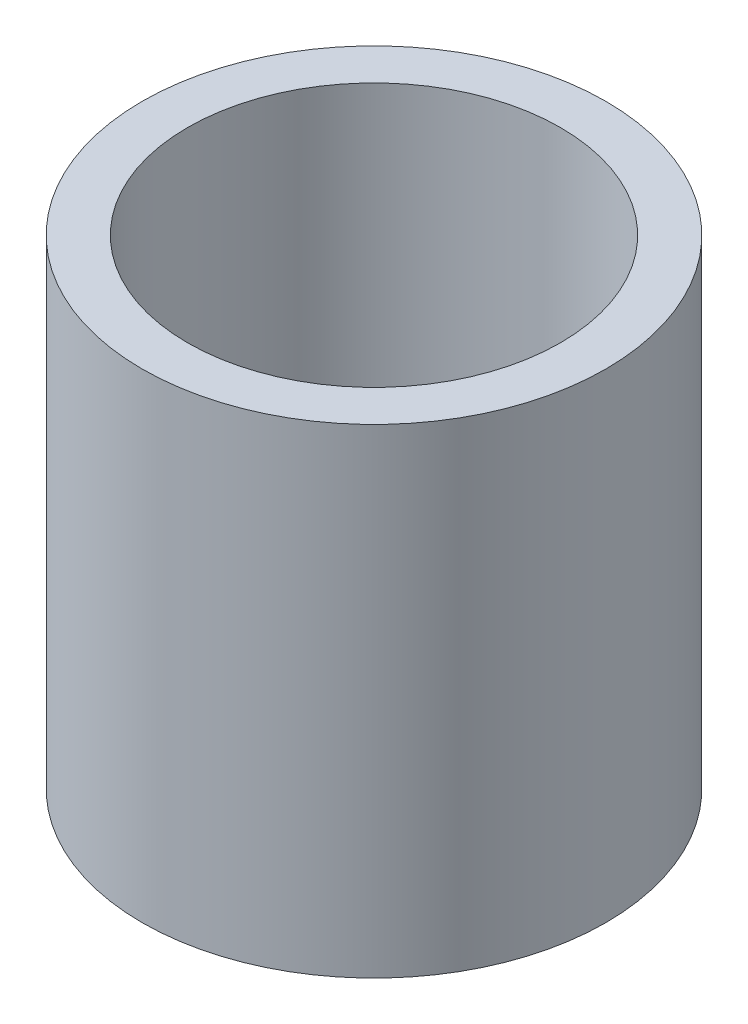
from build123d import *

# Parameters (mm, degrees)
SKETCH1_R           = 27.5
BOSS_EXTRUDE1_DEPTH = 56.877366174
SKETCH2_R           = 22.117933631
CUT_EXTRUDE1_DEPTH  = 69.902356875


with BuildPart() as part:
    # Sketch1 → Boss-Extrude1 (new body)
    with BuildSketch(Plane(origin=(0, 0, 0), x_dir=(1, 0, 0), z_dir=(0, 1, 0))):
        Circle(SKETCH1_R)
    extrude(amount=BOSS_EXTRUDE1_DEPTH)

    # Sketch2 → Cut-Extrude1 (cut, through all)
    with BuildSketch(Plane(origin=(0, 0, 0), x_dir=(1, 0, 0), z_dir=(0, 1, 0))):
        Circle(SKETCH2_R)
    extrude(amount=CUT_EXTRUDE1_DEPTH, mode=Mode.SUBTRACT)


solid = part.part
